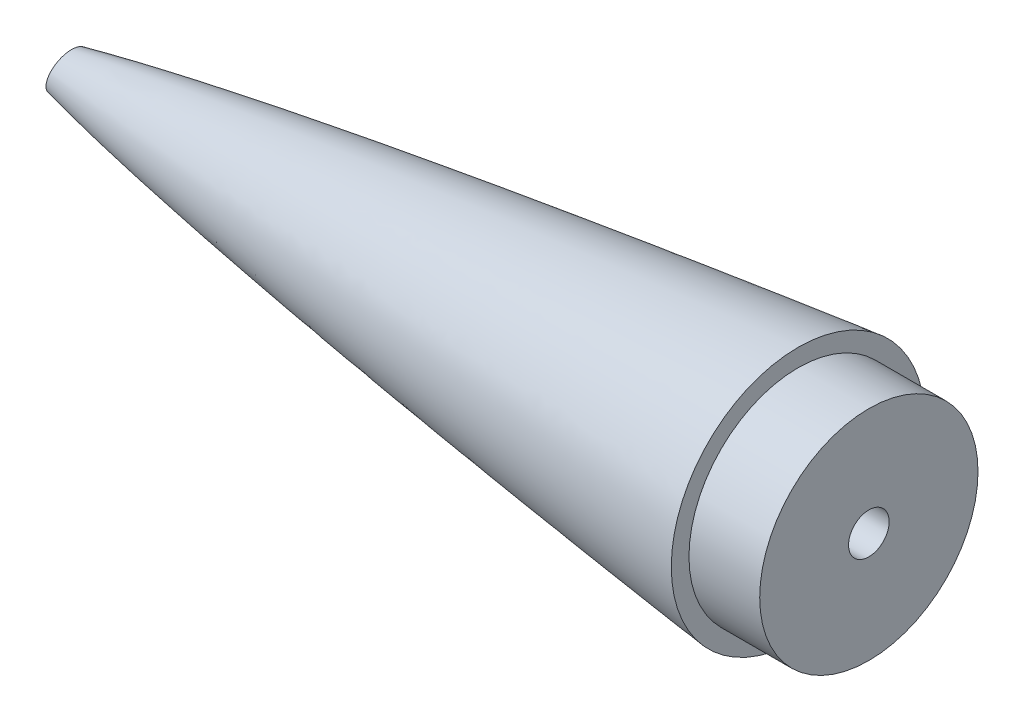
from build123d import *

# Parameters (mm, degrees)
F_1_4_20_TAPPED_HOLE1_D = 5.1054


with BuildPart() as part:
    # Sketch1 → Revolve1 (revolve)
    with BuildSketch(Plane.XY):
        with BuildLine():
            add(Edge.make_bspline(
                [(0.05142254, -0.133795206), (0.055161472, -0.126702709), (0.063846704, -0.113443896), (0.086385301, -0.090857927), (0.123997231, -0.061334579), (0.169647771, -0.029632405), (0.237333421, 0.012112406), (0.320573024, 0.058626249), (0.444018266, 0.121700565), (0.608983152, 0.198218673), (0.802340893, 0.280794479), (1.024099882, 0.368942406), (1.267356062, 0.460311872), (1.532095045, 0.554693469), (1.966901952, 0.702575649), (2.746199863, 0.949265752), (4.168961712, 1.358345956), (6.853306017, 2.043382986), (11.836626773, 3.157081906), (21.278657602, 4.98165519), (38.276629233, 7.791628586), (60.224819499, 10.894752718), (79.66144767, 13.351744234), (94.222006069, 15.079427213), (100.488239409, 15.804704794)],
                knots=[0, 0, 0, 0, 0, 3.9582e-05, 7.9164e-05, 0.000158327, 0.000237491, 0.000316655, 0.000474982, 0.00063331, 0.000927839, 0.001222369, 0.001522181, 0.001821993, 0.002222204, 0.002622415, 0.003809918, 0.005893539, 0.009595772, 0.016421024, 0.029243149, 0.053793085, 0.095411246, 0.126834738, 0.126834738, 0.126834738, 0.126834738, 0.126834738], degree=4))
            Line((0.05142254, -0.133795206), (109.378239409, -0.133795206))
            Line((109.378239409, -0.133795206), (109.378239409, 13.582204794))
            Line((109.378239409, 13.582204794), (100.488239409, 13.582204794))
            Line((100.488239409, 13.582204794), (100.488239409, 15.804704794))
        make_face()
    revolve(axis=Axis((0.05142254, -0.133795206, 0), (1, 0, 0)))

    # 1/4-20 Tapped Hole1 (through all)
    with Locations(Plane(origin=(109.378239409, 0, 0), x_dir=(0, 0, -1), z_dir=(1, 0, 0))):
        with Locations((0, 0)):
            Hole(F_1_4_20_TAPPED_HOLE1_D / 2)


solid = part.part
